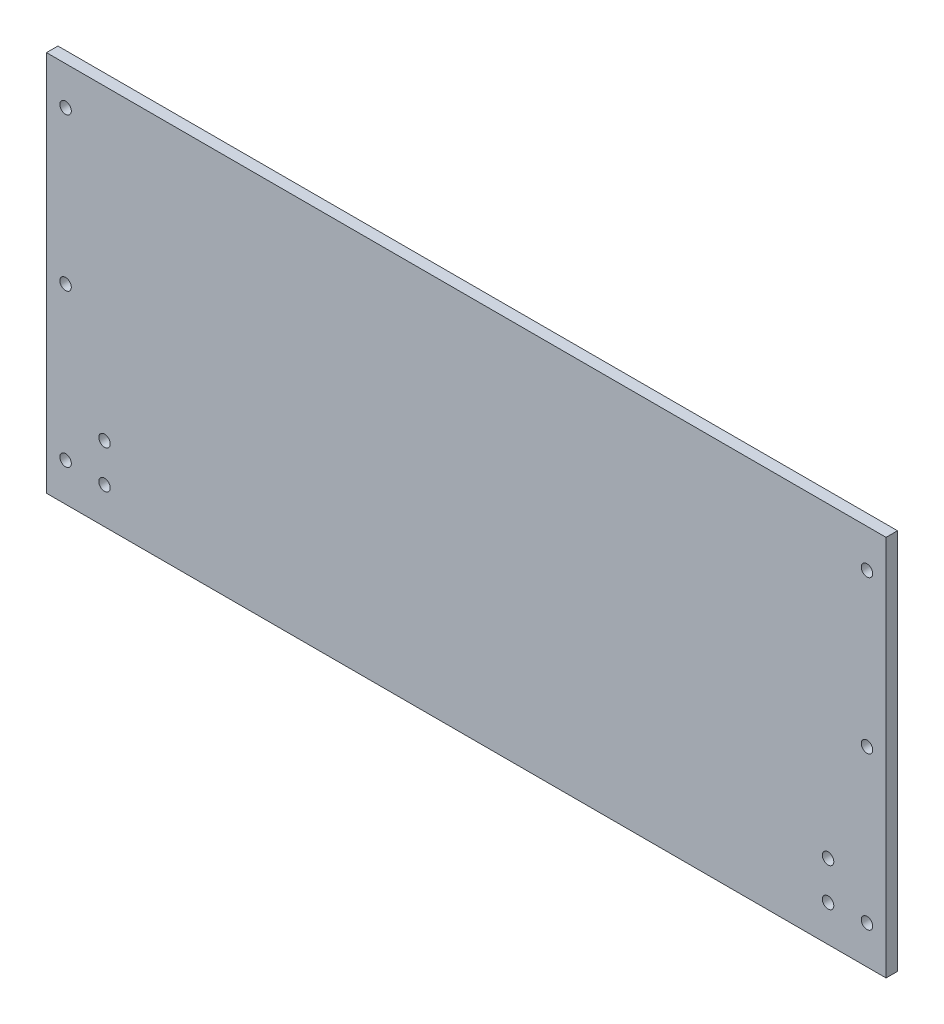
from build123d import *

# Parameters (mm, degrees)
ESQUISSE1_W        = 220
ESQUISSE1_H        = 100
ESQUISSE1_R        = 1.5
BOSS_EXTRU_1_DEPTH = 3


with BuildPart() as part:
    # Esquisse1 → Boss.-Extru.1 (new body)
    with BuildSketch(Plane.XY):
        Rectangle(ESQUISSE1_W, ESQUISSE1_H)
        with Locations((-105, -40)):
            Circle(ESQUISSE1_R, mode=Mode.SUBTRACT)
        with Locations((-105, 0)):
            Circle(ESQUISSE1_R, mode=Mode.SUBTRACT)
        with Locations((-105, 40)):
            Circle(ESQUISSE1_R, mode=Mode.SUBTRACT)
        with Locations((105, 40)):
            Circle(ESQUISSE1_R, mode=Mode.SUBTRACT)
        with Locations((105, 0)):
            Circle(ESQUISSE1_R, mode=Mode.SUBTRACT)
        with Locations((105, -40)):
            Circle(ESQUISSE1_R, mode=Mode.SUBTRACT)
        with Locations((-94.8, -30.455320997)):
            Circle(ESQUISSE1_R, mode=Mode.SUBTRACT)
        with Locations((-94.8, -40.455320997)):
            Circle(ESQUISSE1_R, mode=Mode.SUBTRACT)
        with Locations((94.8, -40.455320997)):
            Circle(ESQUISSE1_R, mode=Mode.SUBTRACT)
        with Locations((94.8, -30.455320997)):
            Circle(ESQUISSE1_R, mode=Mode.SUBTRACT)
    extrude(amount=BOSS_EXTRU_1_DEPTH)


solid = part.part
